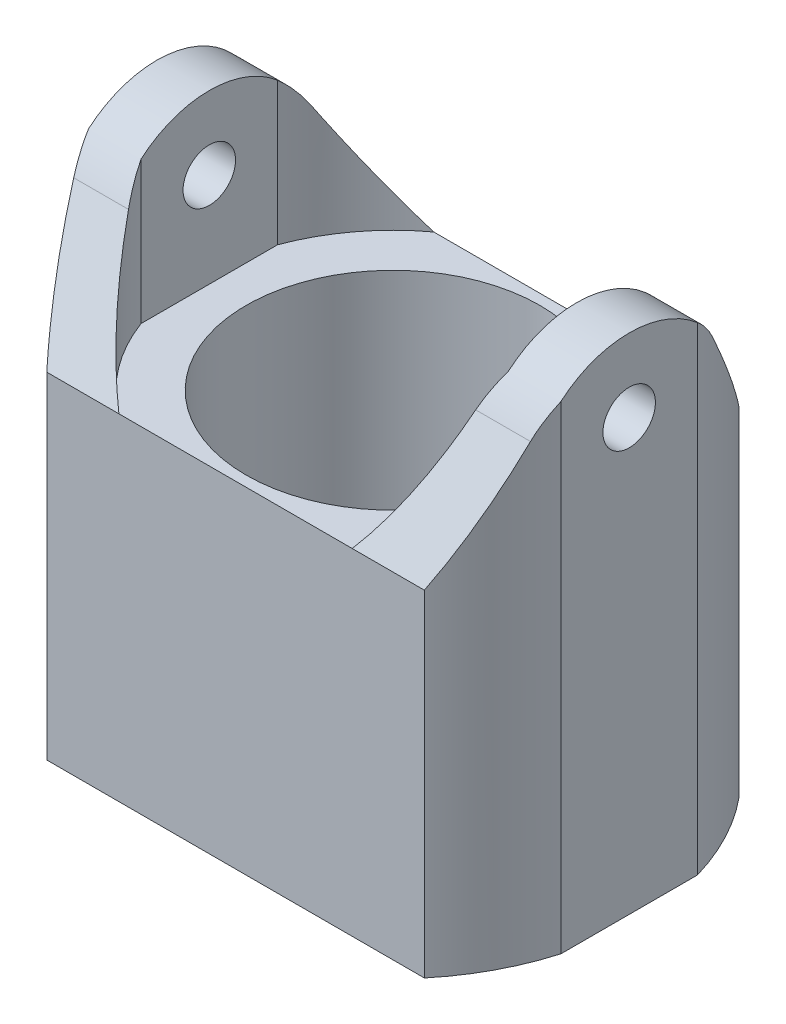
from build123d import *

# Parameters (mm, degrees)
SKETCH1_R              = 14
BOSS_EXTRUDE1_DEPTH    = 32
BOSS_EXTRUDE2_DEPTH    = 45
SKETCH4_R              = 49.397099685
SKETCH4_R_2            = 14
CUT_EXTRUDE1_DEPTH     = 90
FILLET1_R              = 10
SKETCH6_R              = 2.5
CUT_EXTRUDE2_DEPTH     = 90
CUT_EXTRUDE3_START     = -18
CUT_EXTRUDE3_OUTLINE_R = 14
CUT_EXTRUDE3_DEPTH     = 17
SKETCH8_R              = 2.5
CUT_EXTRUDE4_DEPTH     = 6


with BuildPart() as part:
    # Sketch1 → Boss-Extrude1 (new body)
    with BuildSketch(Plane(origin=(0, 0, 0), x_dir=(1, 0, 0), z_dir=(0, 1, 0))):
        with BuildLine():
            ThreePointArc((-22.5, -6.5), (-20.684382748, -10.984366633), (-17.986105749, -15))
            Line((-17.986105749, -15), (17.986105749, -15))
            ThreePointArc((17.986105749, -15), (20.684382748, -10.984366633), (22.5, -6.5))
            Line((22.5, -6.5), (22.5, 6.5))
            ThreePointArc((22.5, 6.5), (20.684382748, 10.984366633), (17.986105749, 15))
            Line((17.986105749, 15), (-17.986105749, 15))
            ThreePointArc((-17.986105749, 15), (-20.684382748, 10.984366633), (-22.5, 6.5))
            Line((-22.5, 6.5), (-22.5, -6.5))
        make_face()
        with Locations(Location((0, 0, 0), (0, 0, 270))):
            Circle(SKETCH1_R, mode=Mode.SUBTRACT)
    extrude(amount=BOSS_EXTRUDE1_DEPTH)

    # Sketch3 → Boss-Extrude2 (add)
    with BuildSketch(Plane(origin=(22.5, 0, 0), x_dir=(0, 0, -1), z_dir=(1, 0, 0))):
        Polygon((-15, 32), (15, 32), (0, 57.980762114), align=None)
    extrude(amount=-BOSS_EXTRUDE2_DEPTH)

    # Sketch4 → Cut-Extrude1 (cut)
    # profile 1 of 2: a face of its own
    with BuildSketch(Plane.XZ):
        Circle(SKETCH4_R)
        with BuildLine():
            ThreePointArc((22.5, 6.5), (23.188916849, 3.282397806), (23.420076857, 0))
            ThreePointArc((23.420076857, 0), (23.188916849, -3.282397806), (22.5, -6.5))
            ThreePointArc((22.5, -6.5), (20.684382748, -10.984366633), (17.986105749, -15))
            ThreePointArc((17.986105749, -15), (0, -23.420076857), (-17.986105749, -15))
            ThreePointArc((-17.986105749, -15), (-20.684382748, -10.984366633), (-22.5, -6.5))
            ThreePointArc((-22.5, -6.5), (-23.420076857, 0), (-22.5, 6.5))
            ThreePointArc((-22.5, 6.5), (-20.684382748, 10.984366633), (-17.986105749, 15))
            ThreePointArc((-17.986105749, 15), (0, 23.420076857), (17.986105749, 15))
            ThreePointArc((17.986105749, 15), (20.684382748, 10.984366633), (22.5, 6.5))
        make_face(mode=Mode.SUBTRACT)
    # profile 2 of 2: a face of its own
    with BuildSketch(Plane.XZ):
        Circle(SKETCH4_R_2)
    extrude(amount=-CUT_EXTRUDE1_DEPTH, mode=Mode.SUBTRACT)

    # Fillet1
    # the kernel refuses this fillet: 10 mm, written as the material it takes off along each edge
    with BuildSketch(Plane(origin=(29.301270189, 57.980762114, 0), x_dir=(0, -0.8660254037844386, -0.5), z_dir=(-1, 0, 0)), Plane(origin=(65.801270189, 57.980762114, 0), x_dir=(0, -0.8660254037844386, -0.5), z_dir=(-1, 0, 0))) as fillet1_piece_1:
        with BuildLine():
            CenterArc((FILLET1_R * 1.73205080757, FILLET1_R), FILLET1_R, 150, 120)
            Line((FILLET1_R * 0.866025403784, FILLET1_R * 1.5), (0, 0))
            Line((0, 0), (FILLET1_R * 1.73205080757, 0))
        make_face()
    extrude(amount=95.102540378, mode=Mode.SUBTRACT)

    # Sketch6 → Cut-Extrude2 (cut)
    with BuildSketch(Plane.ZY.offset(22.5)):
        with Locations((0, 41)):
            Circle(SKETCH6_R)
    extrude(amount=-CUT_EXTRUDE2_DEPTH, mode=Mode.SUBTRACT)

    # Cut-Extrude3: read off the stored shape, not the designer's step
    # Cut-Extrude3 outline → Cut-Extrude3 (cut)
    with BuildSketch(Plane(origin=(0, 50, 0), x_dir=(1, 0, 0), z_dir=(0, 1, 0)).offset(CUT_EXTRUDE3_START)):
        with BuildLine():
            ThreePointArc((-17.5, -6.5), (-14.924450898, -11.21431074), (-11.113055385, -15))
            Line((-11.113055385, -15), (11.113055385, -15))
            ThreePointArc((11.113055385, -15), (14.924450898, -11.21431074), (17.5, -6.5))
            Line((17.5, -6.5), (17.5, 6.5))
            ThreePointArc((17.5, 6.5), (14.924450898, 11.21431074), (11.113055385, 15))
            Line((11.113055385, 15), (-11.113055385, 15))
            ThreePointArc((-11.113055385, 15), (-14.924450898, 11.21431074), (-17.5, 6.5))
            Line((-17.5, 6.5), (-17.5, -6.5))
        make_face()
        Circle(CUT_EXTRUDE3_OUTLINE_R, mode=Mode.SUBTRACT)
    extrude(amount=CUT_EXTRUDE3_DEPTH, mode=Mode.SUBTRACT)

    # Sketch8 → Cut-Extrude4 (cut)
    with BuildSketch(Plane.XZ):
        with Locations(Location((-15.5, 9, 0), (0, 0, 270))):
            Circle(SKETCH8_R)
        with Locations(Location((15.5, 9, 0), (0, 0, 270))):
            Circle(SKETCH8_R)
        with Locations(Location((15.5, -9, 0), (0, 0, 270))):
            Circle(SKETCH8_R)
        with Locations(Location((-15.5, -9, 0), (0, 0, 270))):
            Circle(SKETCH8_R)
    extrude(amount=-CUT_EXTRUDE4_DEPTH, mode=Mode.SUBTRACT)


solid = part.part
